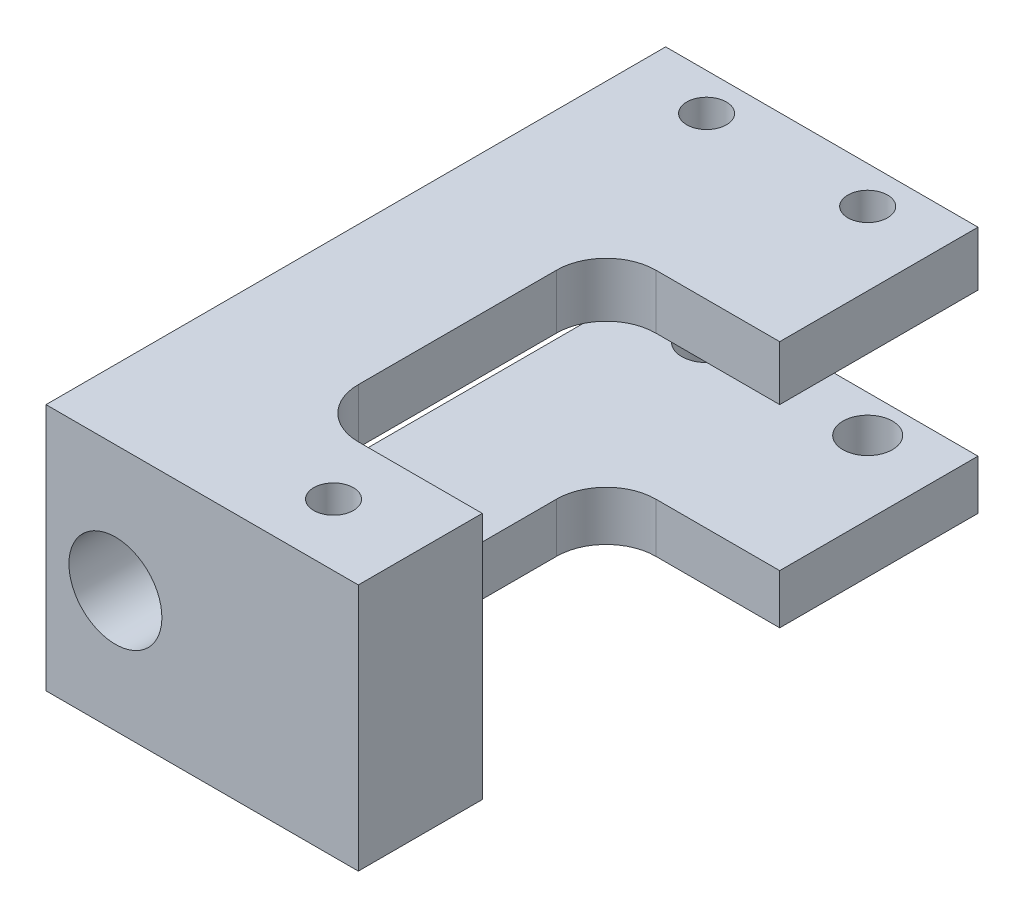
from build123d import *

# Parameters (mm, degrees)
SKETCH1_W                   = 12.6
SKETCH1_H                   = 25
BOSS_EXTRUDE1_DEPTH         = 10
CUT_EXTRUDE9_START          = -5
SKETCH14_W                  = 7
SKETCH14_H                  = 5.8
CUT_EXTRUDE9_DEPTH          = 20
SKETCH15_W                  = 20
SKETCH15_H                  = 5.8
CUT_EXTRUDE10_DEPTH         = 18.47140521
CUT_EXTRUDE11_DEPTH         = 17.122654868
CUT_EXTRUDE11_DEPTH_BACK    = 17.122654868
SKETCH17_W                  = 7
SKETCH17_H                  = 12
SKETCH18_R                  = 1.875
CUT_EXTRUDE12_DEPTH         = 24.231228982
FILLET2_R                   = 2
SKETCH20_R                  = 1
CUT_EXTRUDE18_DEPTH         = 5
TAP_DRILL_FOR_M2X0_4_TAP2_D = 1.6
TAP_DRILL_FOR_M2X0_4_TAP3_D = 1.6
FILLET4_R                   = 0.2


with BuildPart() as part:
    # Sketch1 → Boss-Extrude1 (new body)
    with BuildSketch(Plane(origin=(0, 0, 0), x_dir=(1, 0, 0), z_dir=(0, 1, 0))):
        Rectangle(SKETCH1_W, SKETCH1_H)
    extrude(amount=BOSS_EXTRUDE1_DEPTH)

    # Sketch14 → Cut-Extrude9 (cut)
    with BuildSketch(Plane.XY.offset(12.5).offset(CUT_EXTRUDE9_START)):
        with Locations((2.8, 4.9)):
            Rectangle(SKETCH14_W, SKETCH14_H)
    extrude(amount=-CUT_EXTRUDE9_DEPTH, mode=Mode.SUBTRACT)

    # Sketch15 → Cut-Extrude10 (cut, through all)
    with BuildSketch(Plane(origin=(-0.7, 0, 0), x_dir=(0, 0, -1), z_dir=(1, 0, 0))):
        with Locations((2.5, 4.9)):
            Rectangle(SKETCH15_W, SKETCH15_H)
    extrude(amount=-CUT_EXTRUDE10_DEPTH, mode=Mode.SUBTRACT)

    # Sketch17 → Cut-Extrude11 (cut, two sides: drawn at the far end of the back side and taken through both)
    with BuildSketch(Plane(origin=(0, 2, 0), x_dir=(1, 0, 0), z_dir=(0, 1, 0)).offset(-CUT_EXTRUDE11_DEPTH_BACK)):
        with Locations((2.8, -1.5)):
            Rectangle(SKETCH17_W, SKETCH17_H)
    extrude(amount=CUT_EXTRUDE11_DEPTH + CUT_EXTRUDE11_DEPTH_BACK, mode=Mode.SUBTRACT)

    # Sketch18 → Cut-Extrude12 (cut, through all)
    with BuildSketch(Plane(origin=(0, 0, 7.5), x_dir=(-1, 0, 0), z_dir=(0, 0, -1))):
        with Locations((3.5, 4.9)):
            Circle(SKETCH18_R)
    extrude(amount=-CUT_EXTRUDE12_DEPTH, mode=Mode.SUBTRACT)

    # Fillet2
    fillet2_edges = [part.edges().sort_by_distance(p)[0] for p in [
        (-0.7, 8.9, -4.5),
        (-0.7, 1, -4.5),
        (-0.7, 1, 7.5),
        (-0.7, 8.9, 7.5),
    ]]
    fillet(fillet2_edges, radius=FILLET2_R)

    # Sketch20 → Cut-Extrude18 (cut)
    with BuildSketch(Plane.XZ):
        with Locations((3.35, -11)):
            Circle(SKETCH20_R)
        with Locations((-3.15, -11)):
            Circle(SKETCH20_R)
    extrude(amount=-CUT_EXTRUDE18_DEPTH, mode=Mode.SUBTRACT)

    # Tap Drill for M2x0.4 Tap2 (through all)
    with Locations(Plane(origin=(3.35, 10, -11), x_dir=(0, 0, 1), z_dir=(0, 1, 0))):
        with Locations((0, 0), (0, -6.5)):
            Hole(TAP_DRILL_FOR_M2X0_4_TAP2_D / 2)

    # Tap Drill for M2x0.4 Tap3 (through all)
    with Locations(Plane(origin=(2.8, 10, 10), x_dir=(0, 0, 1), z_dir=(0, 1, 0))):
        with Locations((0, 0)):
            Hole(TAP_DRILL_FOR_M2X0_4_TAP3_D / 2)

    # Fillet4
    fillet4_edges = [part.edges().sort_by_distance(p)[0] for p in [
        (-2.5, 7.8, 7.5),
        (-2.5, 2, 7.5),
    ]]
    fillet(fillet4_edges, radius=FILLET4_R)


solid = part.part
